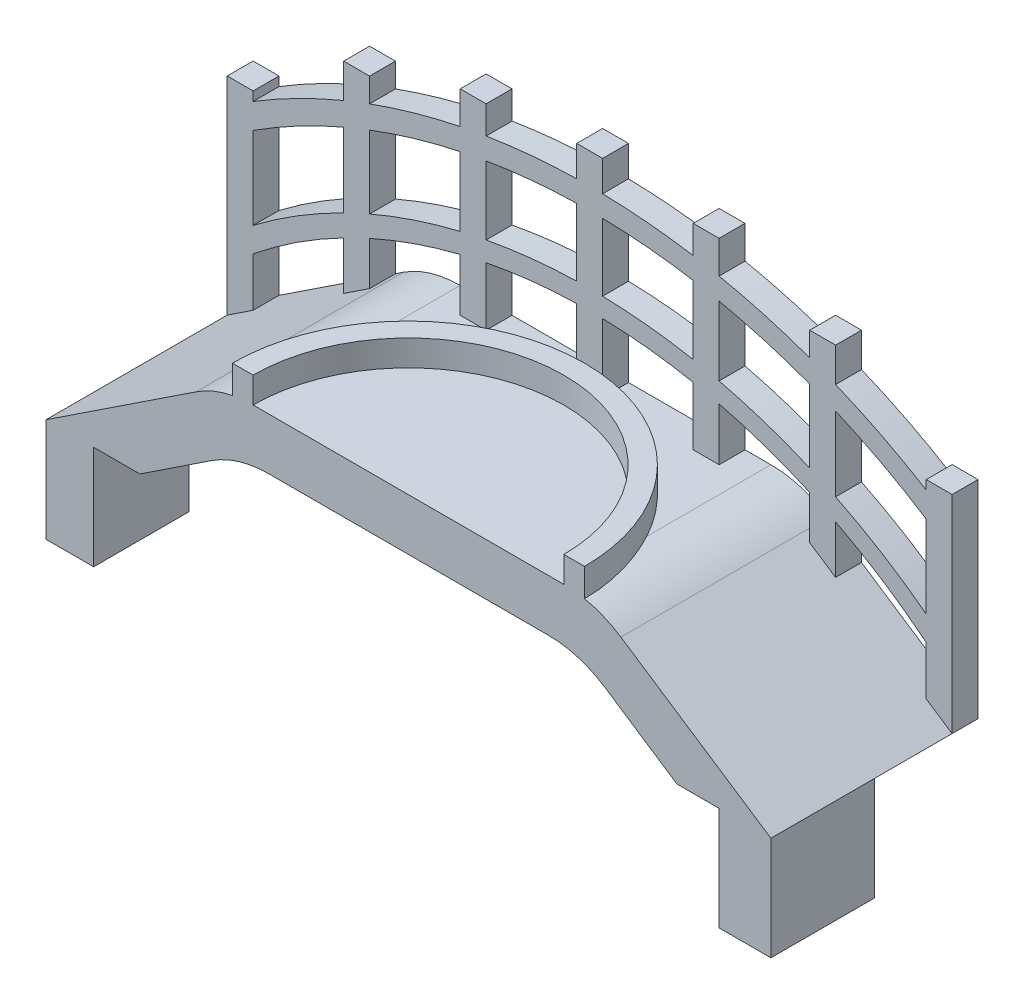
from build123d import *

# Parameters (mm, degrees)
BOSS_EXTRUDE1_DEPTH      = 12.7
BOSS_EXTRUDE2_DEPTH      = 1.5875
SKETCH5_7_W              = 1.5875
SKETCH5_7_H              = 15.875
SKETCH5_7_H_2            = 12.7
BOSS_EXTRUDE6_DEPTH      = 1.5875
BOSS_EXTRUDE7_DEPTH      = 1.5875
BOSS_EXTRUDE9_DEPTH      = 1.5875
BOSS_EXTRUDE9_DEPTH_BACK = 0.254
SKETCH12_W               = 2.921
SKETCH12_H               = 5.842
SKETCH12_W_2             = 3.175
SKETCH12_H_2             = 6.35
BOSS_EXTRUDE10_DEPTH     = 6.35


with BuildPart() as part:
    # Sketch5 → Boss-Extrude1 (new body)
    with BuildSketch(Plane.XY):
        with BuildLine():
            Line((5.757097876, 0), (10.152663822, 2.905998883))
            ThreePointArc((10.152663822, 2.905998883), (11.826216975, 3.690024401), (13.654645278, 3.958959532))
            Line((13.654645278, 3.958959532), (30.795354722, 3.958959532))
            ThreePointArc((30.795354722, 3.958959532), (32.623783025, 3.690024401), (34.297336178, 2.905998883))
            Line((34.297336178, 2.905998883), (38.692902124, 0))
            Line((38.692902124, 0), (44.45, 0))
            Line((44.45, 0), (35.251981456, 6.080998883))
            ThreePointArc((35.251981456, 6.080998883), (33.578428304, 6.865024401), (31.75, 7.133959532))
            Line((31.75, 7.133959532), (12.7, 7.133959532))
            ThreePointArc((12.7, 7.133959532), (10.871571696, 6.865024401), (9.198018544, 6.080998883))
            Line((9.198018544, 6.080998883), (0, 0))
            Line((0, 0), (5.757097876, 0))
        make_face()
    extrude(amount=BOSS_EXTRUDE1_DEPTH)



with BuildPart() as body_2:
    # Sketch5<4> → Boss-Extrude2 (new body)
    with BuildSketch(Plane.XY):
        with BuildLine():
            Line((0, 11.1125), (0, 9.525))
            ThreePointArc((0, 9.525), (22.225, 16.658959532), (44.45, 9.525))
            Line((44.45, 9.525), (44.45, 11.1125))
            ThreePointArc((44.45, 11.1125), (22.225, 17.96069625), (0, 11.1125))
        make_face()
    extrude(amount=BOSS_EXTRUDE2_DEPTH)

    # Sketch5<7> → Boss-Extrude6 (add)
    with BuildSketch(Plane.XY):
        with Locations((7.9375, 9.122908395)):
            Rectangle(SKETCH5_7_W, SKETCH5_7_H)
        Polygon((0, 0), (1.5875, 1.049528839), (1.5875, 12.7), (0, 12.7), align=None)
        with Locations((15.08125, 11.222301738)):
            Rectangle(SKETCH5_7_W, SKETCH5_7_H)
        with Locations((22.225, 11.896459532)):
            Rectangle(SKETCH5_7_W, SKETCH5_7_H)
        with BuildLine():
            Line((28.575, 3.284801738), (30.1625, 3.284801738))
            Line((30.1625, 3.284801738), (30.1625, 15.824904204))
            ThreePointArc((30.1625, 15.824904204), (29.370349797, 15.984497043), (28.575, 16.127292418))
            Line((28.575, 16.127292418), (28.575, 3.284801738))
        make_face()
        with BuildLine():
            Line((28.575, 19.159801738), (28.575, 17.446790716))
            ThreePointArc((28.575, 17.446790716), (29.370242514, 17.308866955), (30.1625, 17.154718663))
            Line((30.1625, 17.154718663), (30.1625, 19.159801738))
            Line((30.1625, 19.159801738), (28.575, 19.159801738))
        make_face()
        with Locations((36.5125, 9.122908395)):
            Rectangle(SKETCH5_7_W, SKETCH5_7_H)
        with Locations((43.65625, 6.35)):
            Rectangle(SKETCH5_7_W, SKETCH5_7_H_2)
    extrude(amount=BOSS_EXTRUDE6_DEPTH)


with BuildPart() as part_1:
    add(part.part)

    add(body_2.part)  # Boss-Extrude7 merges body 2
    # Sketch6 → Boss-Extrude7 (add)
    with BuildSketch(Plane(origin=(0, 0, 0), x_dir=(-1, 0, 0), z_dir=(0, 0, -1))):
        with BuildLine():
            Line((-44.45, 4.270423014), (-44.45, 2.682923014))
            ThreePointArc((-44.45, 2.682923014), (-22.225, 11.337252313), (0, 2.682923014))
            Line((0, 2.682923014), (0, 4.270423014))
            ThreePointArc((0, 4.270423014), (-22.225, 12.523643082), (-44.45, 4.270423014))
        make_face()
    extrude(amount=-BOSS_EXTRUDE7_DEPTH)

    # Sketch11 → Boss-Extrude9 (add, two sides: drawn at the far end of the back side and taken through both)
    with BuildSketch(Plane(origin=(0, 7.133959532, 0), x_dir=(1, 0, 0), z_dir=(0, 1, 0)).offset(-BOSS_EXTRUDE9_DEPTH_BACK)):
        with BuildLine():
            Line((11.43, -12.7), (12.7, -12.7))
            ThreePointArc((12.7, -12.7), (22.225, -3.175), (31.75, -12.7))
            Line((31.75, -12.7), (33.02, -12.7))
            ThreePointArc((33.02, -12.7), (22.225, -1.905), (11.43, -12.7))
        make_face()
    extrude(amount=BOSS_EXTRUDE9_DEPTH + BOSS_EXTRUDE9_DEPTH_BACK)

    # Sketch12 → Boss-Extrude10 (add)
    with BuildSketch(Plane.XZ):
        with Locations((1.4605, 9.779)):
            Rectangle(SKETCH12_W, SKETCH12_H)
        with Locations((42.8625, 9.525)):
            Rectangle(SKETCH12_W_2, SKETCH12_H_2)
    extrude(amount=BOSS_EXTRUDE10_DEPTH)


solid = part_1.part
